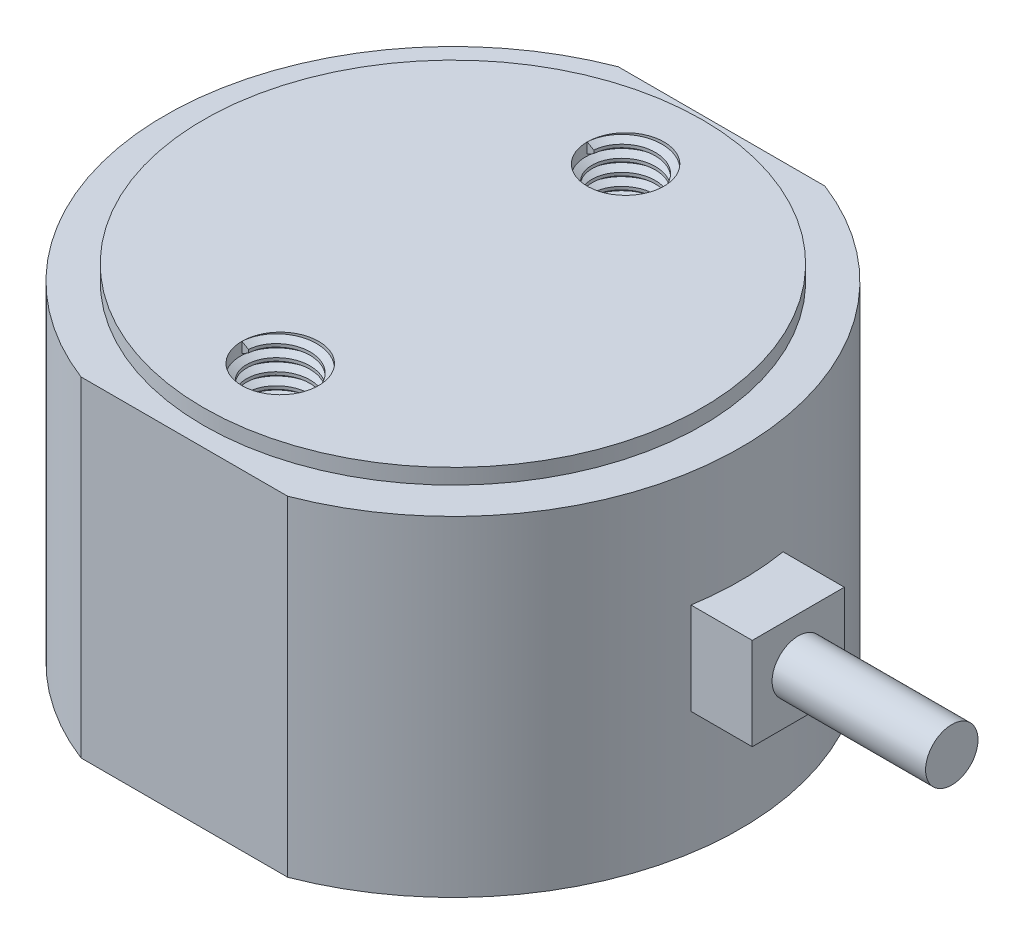
from build123d import *

# Parameters (mm, degrees)
SKETCH_1_R          = 7.5
EXTRUDE_1_DEPTH     = 8.6
SKETCH_2_R          = 6.5
EXTRUDE_2_DEPTH     = 0.4
SKETCH_3_W          = 9.413681744
SKETCH_3_H          = 1.250654203
CUT_EXTRUDE_3_DEPTH = 14.910427743
SKETCH_4_R          = 1
CUT_EXTRUDE_6_DEPTH = 3
THREAD_1_PITCH      = 0.3175
THREAD_2_PITCH      = 0.3175
CUT_EXTRUDE_START   = -3
SKETCH_9_R          = 1
CUT_EXTRUDE_7_DEPTH = 3
THREAD_3_PITCH      = 0.3175
THREAD_4_PITCH      = 0.3175
SKETCH_14_W         = 2.4
SKETCH_14_H         = 2.4
EXTRUDE_3_DEPTH     = 9
SKETCH_15_R         = 0.683184186
EXTRUDE_4_DEPTH     = 4


with BuildPart() as part:
    # Sketch 1 → 凸台-拉伸1 (new body)
    with BuildSketch(Plane(origin=(0, 0, 0), x_dir=(1, 0, 0), z_dir=(0, 1, 0))):
        with Locations(Location((0, 0, 0), (0, 0, 90))):
            Circle(SKETCH_1_R)
    extrude(amount=EXTRUDE_1_DEPTH)

    # Sketch 2 → 凸台-拉伸2 (add)
    with BuildSketch(Plane(origin=(0, 8.6, 0), x_dir=(1, 0, 0), z_dir=(0, 1, 0))):
        with Locations(Location((0, 0, 0), (0, 0, 270))):
            Circle(SKETCH_2_R)
    extrude(amount=EXTRUDE_2_DEPTH)

    # Sketch 3 → 切除-拉伸3 (cut, through all)
    with BuildSketch(Plane(origin=(0, 0, 0), x_dir=(1, 0, 0), z_dir=(0, 1, 0))):
        with Locations((0, -7.625327101)):
            Rectangle(SKETCH_3_W, SKETCH_3_H)
        with Locations((0, 7.625327101)):
            Rectangle(SKETCH_3_W, SKETCH_3_H)
    extrude(amount=CUT_EXTRUDE_3_DEPTH, mode=Mode.SUBTRACT)

    # Sketch 4 → 切除-拉伸6 (cut)
    with BuildSketch(Plane(origin=(0, 0, 0), x_dir=(1, 0, 0), z_dir=(0, 1, 0))):
        with Locations(Location((0, 4.5, 0), (0, 0, 270))):
            Circle(SKETCH_4_R)
        with Locations(Location((0, -4.5, 0), (0, 0, 90))):
            Circle(SKETCH_4_R)
    extrude(amount=CUT_EXTRUDE_6_DEPTH, mode=Mode.SUBTRACT)

    # 螺纹线1: the profile of Sketch 1 2 profile screwed along a right-hand helix of 9.448819 turns, 6 arcs to a turn; built about Z, then put on its axis
    thread_1_z = Axis((0, 0, 0), (0, 0, 1))
    thread_1_corners = [(1.0003, 0, -0.000173205), (1.0003, 0, 0.277985704), (0.828148085, 0, 0.17859375), (0.828148085, 0, 0.09921875)]
    with BuildLine(mode=Mode.PRIVATE) as thread_1_profile:
        Line(thread_1_corners[0], thread_1_corners[1])
        Line(thread_1_corners[1], thread_1_corners[2])
        Line(thread_1_corners[2], thread_1_corners[3])
        Line(thread_1_corners[3], thread_1_corners[0])
    thread_1_cap = Face(thread_1_profile.wire())
    thread_1_turn_angles = [0, 30, 60, 90, 120, 150, 180, 210, 240, 270, 300, 330, 360]
    thread_1_turn_weights = [1, 0.8660254037844387, 1, 0.8660254037844387, 1, 0.8660254037844387, 1, 0.8660254037844387, 1, 0.8660254037844387, 1, 0.8660254037844387, 1]
    thread_1_turn_rails = [Edge.make_bspline([Vector(p[0], p[1], 0).rotate(thread_1_z, thread_1_turn_angles[k]) / thread_1_turn_weights[k] + Vector(0, 0, p[2] + THREAD_1_PITCH * thread_1_turn_angles[k] / 360) for k in range(13)], [0, 0, 0, 1, 1, 2, 2, 3, 3, 4, 4, 5, 5, 6, 6, 6], 2, thread_1_turn_weights) for p in thread_1_corners]
    thread_1_turn_sides = [Face.make_surface_from_curves(thread_1_turn_rails[p[0]], thread_1_turn_rails[p[1]]) for p in [(0, 1), (1, 2), (2, 3), (3, 0)]]
    thread_1_last_angles = [3240, 3270, 3300, 3330, 3360, 3380.787401575, 3401.57480315]
    thread_1_last_weights = [1, 0.8660254037844387, 1, 0.8660254037844387, 1, 0.9349037361358654, 1]
    thread_1_last_rails = [Edge.make_bspline([Vector(p[0], p[1], 0).rotate(thread_1_z, thread_1_last_angles[k]) / thread_1_last_weights[k] + Vector(0, 0, p[2] + THREAD_1_PITCH * thread_1_last_angles[k] / 360) for k in range(7)], [0, 0, 0, 1, 1, 2, 2, 3, 3, 3], 2, thread_1_last_weights) for p in thread_1_corners]
    thread_1_last_sides = [Face.make_surface_from_curves(thread_1_last_rails[p[0]], thread_1_last_rails[p[1]]) for p in [(0, 1), (1, 2), (2, 3), (3, 0)]]
    thread_1 = Plane(origin=(0, 0, -4.5), x_dir=(1, 0, 0), z_dir=(0, 1, 0)) * Solid(Shell([*[p.moved(Location((0, 0, THREAD_1_PITCH * i))) for i in range(9) for p in thread_1_turn_sides], *thread_1_last_sides, thread_1_cap, thread_1_cap.rotate(thread_1_z, 3401.57480315).moved(Location((0, 0, THREAD_1_PITCH * 3401.57480315 / 360)))]))
    add(thread_1)

    # 螺纹线2: the profile of Sketch 2 2 profile screwed along a right-hand helix of 9.448819 turns, 6 arcs to a turn; built about Z, then put on its axis
    thread_2_z = Axis((0, 0, 0), (0, 0, 1))
    thread_2_corners = [(1.0003, 0, -0.000173205), (1.0003, 0, 0.277985704), (0.828148085, 0, 0.17859375), (0.828148085, 0, 0.09921875)]
    with BuildLine(mode=Mode.PRIVATE) as thread_2_profile:
        Line(thread_2_corners[0], thread_2_corners[1])
        Line(thread_2_corners[1], thread_2_corners[2])
        Line(thread_2_corners[2], thread_2_corners[3])
        Line(thread_2_corners[3], thread_2_corners[0])
    thread_2_cap = Face(thread_2_profile.wire())
    thread_2_turn_angles = [0, 30, 60, 90, 120, 150, 180, 210, 240, 270, 300, 330, 360]
    thread_2_turn_weights = [1, 0.8660254037844387, 1, 0.8660254037844387, 1, 0.8660254037844387, 1, 0.8660254037844387, 1, 0.8660254037844387, 1, 0.8660254037844387, 1]
    thread_2_turn_rails = [Edge.make_bspline([Vector(p[0], p[1], 0).rotate(thread_2_z, thread_2_turn_angles[k]) / thread_2_turn_weights[k] + Vector(0, 0, p[2] + THREAD_2_PITCH * thread_2_turn_angles[k] / 360) for k in range(13)], [0, 0, 0, 1, 1, 2, 2, 3, 3, 4, 4, 5, 5, 6, 6, 6], 2, thread_2_turn_weights) for p in thread_2_corners]
    thread_2_turn_sides = [Face.make_surface_from_curves(thread_2_turn_rails[p[0]], thread_2_turn_rails[p[1]]) for p in [(0, 1), (1, 2), (2, 3), (3, 0)]]
    thread_2_last_angles = [3240, 3270, 3300, 3330, 3360, 3380.787401575, 3401.57480315]
    thread_2_last_weights = [1, 0.8660254037844387, 1, 0.8660254037844387, 1, 0.9349037361358654, 1]
    thread_2_last_rails = [Edge.make_bspline([Vector(p[0], p[1], 0).rotate(thread_2_z, thread_2_last_angles[k]) / thread_2_last_weights[k] + Vector(0, 0, p[2] + THREAD_2_PITCH * thread_2_last_angles[k] / 360) for k in range(7)], [0, 0, 0, 1, 1, 2, 2, 3, 3, 3], 2, thread_2_last_weights) for p in thread_2_corners]
    thread_2_last_sides = [Face.make_surface_from_curves(thread_2_last_rails[p[0]], thread_2_last_rails[p[1]]) for p in [(0, 1), (1, 2), (2, 3), (3, 0)]]
    thread_2 = Plane(origin=(0, 0, 4.5), x_dir=(1, 0, 0), z_dir=(0, 1, 0)) * Solid(Shell([*[p.moved(Location((0, 0, THREAD_2_PITCH * i))) for i in range(9) for p in thread_2_turn_sides], *thread_2_last_sides, thread_2_cap, thread_2_cap.rotate(thread_2_z, 3401.57480315).moved(Location((0, 0, THREAD_2_PITCH * 3401.57480315 / 360)))]))
    add(thread_2)

    # 草图9 → 切除-拉伸7 (cut)
    with BuildSketch(Plane(origin=(0, 9, 0), x_dir=(1, 0, 0), z_dir=(0, 1, 0)).offset(CUT_EXTRUDE_START)):
        with Locations(Location((0, 4.5, 0), (0, 0, 270))):
            Circle(SKETCH_9_R)
        with Locations(Location((0, -4.5, 0), (0, 0, 90))):
            Circle(SKETCH_9_R)
    extrude(amount=CUT_EXTRUDE_7_DEPTH, mode=Mode.SUBTRACT)

    # 螺纹线3: the profile of Sketch 3 2 profile screwed along a right-hand helix of 9.448819 turns, 6 arcs to a turn; built about Z, then put on its axis
    thread_3_z = Axis((0, 0, 0), (0, 0, 1))
    thread_3_corners = [(1.0003, 0, -0.000173205), (1.0003, 0, 0.277985704), (0.828148085, 0, 0.17859375), (0.828148085, 0, 0.09921875)]
    with BuildLine(mode=Mode.PRIVATE) as thread_3_profile:
        Line(thread_3_corners[0], thread_3_corners[1])
        Line(thread_3_corners[1], thread_3_corners[2])
        Line(thread_3_corners[2], thread_3_corners[3])
        Line(thread_3_corners[3], thread_3_corners[0])
    thread_3_cap = Face(thread_3_profile.wire())
    thread_3_turn_angles = [0, 30, 60, 90, 120, 150, 180, 210, 240, 270, 300, 330, 360]
    thread_3_turn_weights = [1, 0.8660254037844387, 1, 0.8660254037844387, 1, 0.8660254037844387, 1, 0.8660254037844387, 1, 0.8660254037844387, 1, 0.8660254037844387, 1]
    thread_3_turn_rails = [Edge.make_bspline([Vector(p[0], p[1], 0).rotate(thread_3_z, thread_3_turn_angles[k]) / thread_3_turn_weights[k] + Vector(0, 0, p[2] + THREAD_3_PITCH * thread_3_turn_angles[k] / 360) for k in range(13)], [0, 0, 0, 1, 1, 2, 2, 3, 3, 4, 4, 5, 5, 6, 6, 6], 2, thread_3_turn_weights) for p in thread_3_corners]
    thread_3_turn_sides = [Face.make_surface_from_curves(thread_3_turn_rails[p[0]], thread_3_turn_rails[p[1]]) for p in [(0, 1), (1, 2), (2, 3), (3, 0)]]
    thread_3_last_angles = [3240, 3270, 3300, 3330, 3360, 3380.787401575, 3401.57480315]
    thread_3_last_weights = [1, 0.8660254037844387, 1, 0.8660254037844387, 1, 0.9349037361358654, 1]
    thread_3_last_rails = [Edge.make_bspline([Vector(p[0], p[1], 0).rotate(thread_3_z, thread_3_last_angles[k]) / thread_3_last_weights[k] + Vector(0, 0, p[2] + THREAD_3_PITCH * thread_3_last_angles[k] / 360) for k in range(7)], [0, 0, 0, 1, 1, 2, 2, 3, 3, 3], 2, thread_3_last_weights) for p in thread_3_corners]
    thread_3_last_sides = [Face.make_surface_from_curves(thread_3_last_rails[p[0]], thread_3_last_rails[p[1]]) for p in [(0, 1), (1, 2), (2, 3), (3, 0)]]
    thread_3 = Plane(origin=(0, 9, -4.5), x_dir=(-1, 0, 0), z_dir=(0, -1, 0)) * Solid(Shell([*[p.moved(Location((0, 0, THREAD_3_PITCH * i))) for i in range(9) for p in thread_3_turn_sides], *thread_3_last_sides, thread_3_cap, thread_3_cap.rotate(thread_3_z, 3401.57480315).moved(Location((0, 0, THREAD_3_PITCH * 3401.57480315 / 360)))]))
    add(thread_3)

    # 螺纹线4: the profile of Sketch 4 2 profile screwed along a right-hand helix of 9.448819 turns, 6 arcs to a turn; built about Z, then put on its axis
    thread_4_z = Axis((0, 0, 0), (0, 0, 1))
    thread_4_corners = [(1.0003, 0, -0.000173205), (1.0003, 0, 0.277985704), (0.828148085, 0, 0.17859375), (0.828148085, 0, 0.09921875)]
    with BuildLine(mode=Mode.PRIVATE) as thread_4_profile:
        Line(thread_4_corners[0], thread_4_corners[1])
        Line(thread_4_corners[1], thread_4_corners[2])
        Line(thread_4_corners[2], thread_4_corners[3])
        Line(thread_4_corners[3], thread_4_corners[0])
    thread_4_cap = Face(thread_4_profile.wire())
    thread_4_turn_angles = [0, 30, 60, 90, 120, 150, 180, 210, 240, 270, 300, 330, 360]
    thread_4_turn_weights = [1, 0.8660254037844387, 1, 0.8660254037844387, 1, 0.8660254037844387, 1, 0.8660254037844387, 1, 0.8660254037844387, 1, 0.8660254037844387, 1]
    thread_4_turn_rails = [Edge.make_bspline([Vector(p[0], p[1], 0).rotate(thread_4_z, thread_4_turn_angles[k]) / thread_4_turn_weights[k] + Vector(0, 0, p[2] + THREAD_4_PITCH * thread_4_turn_angles[k] / 360) for k in range(13)], [0, 0, 0, 1, 1, 2, 2, 3, 3, 4, 4, 5, 5, 6, 6, 6], 2, thread_4_turn_weights) for p in thread_4_corners]
    thread_4_turn_sides = [Face.make_surface_from_curves(thread_4_turn_rails[p[0]], thread_4_turn_rails[p[1]]) for p in [(0, 1), (1, 2), (2, 3), (3, 0)]]
    thread_4_last_angles = [3240, 3270, 3300, 3330, 3360, 3380.787401575, 3401.57480315]
    thread_4_last_weights = [1, 0.8660254037844387, 1, 0.8660254037844387, 1, 0.9349037361358654, 1]
    thread_4_last_rails = [Edge.make_bspline([Vector(p[0], p[1], 0).rotate(thread_4_z, thread_4_last_angles[k]) / thread_4_last_weights[k] + Vector(0, 0, p[2] + THREAD_4_PITCH * thread_4_last_angles[k] / 360) for k in range(7)], [0, 0, 0, 1, 1, 2, 2, 3, 3, 3], 2, thread_4_last_weights) for p in thread_4_corners]
    thread_4_last_sides = [Face.make_surface_from_curves(thread_4_last_rails[p[0]], thread_4_last_rails[p[1]]) for p in [(0, 1), (1, 2), (2, 3), (3, 0)]]
    thread_4 = Plane(origin=(0, 9, 4.5), x_dir=(-1, 0, 0), z_dir=(0, -1, 0)) * Solid(Shell([*[p.moved(Location((0, 0, THREAD_4_PITCH * i))) for i in range(9) for p in thread_4_turn_sides], *thread_4_last_sides, thread_4_cap, thread_4_cap.rotate(thread_4_z, 3401.57480315).moved(Location((0, 0, THREAD_4_PITCH * 3401.57480315 / 360)))]))
    add(thread_4)

    # 草图14 → 凸台-拉伸3 (add)
    with BuildSketch(Plane(origin=(0, 0, 0), x_dir=(0, 0, -1), z_dir=(1, 0, 0))):
        with Locations((0, 4.4)):
            Rectangle(SKETCH_14_W, SKETCH_14_H)
    extrude(amount=EXTRUDE_3_DEPTH)

    # 草图15 → 凸台-拉伸4 (add)
    with BuildSketch(Plane(origin=(9, 0, 0), x_dir=(0, 0, -1), z_dir=(1, 0, 0))):
        with Locations((0, 4.417688263)):
            Circle(SKETCH_15_R)
    extrude(amount=EXTRUDE_4_DEPTH)


solid = part.part
